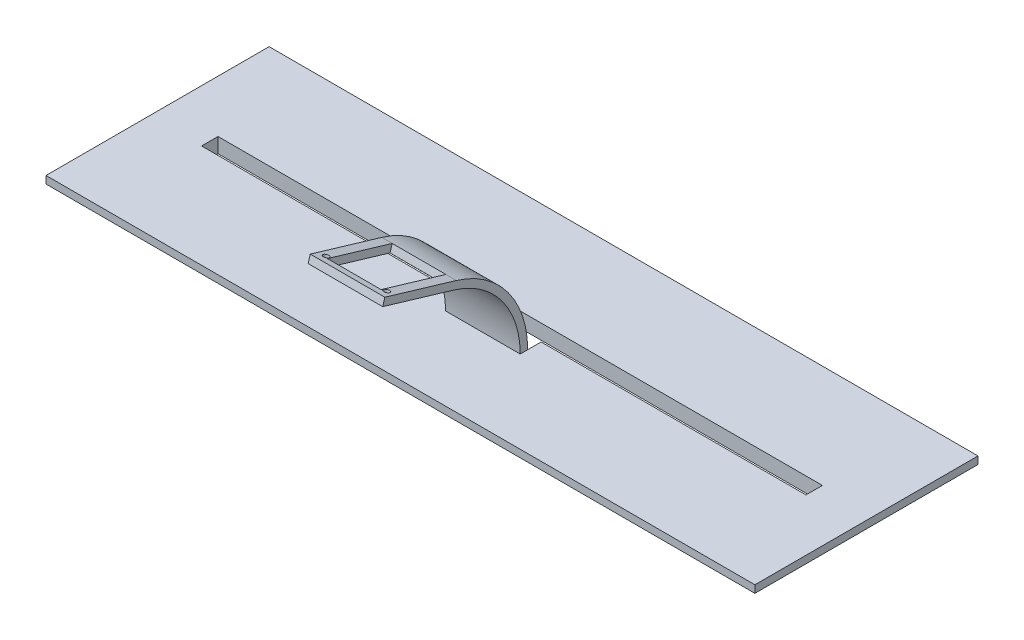
from build123d import *

# Parameters (mm, degrees)
SKETCH1_W                = 234.95
SKETCH1_H                = 69.596
BOSS_EXTRUDE1_DEPTH      = 2.54
SKETCH2_W                = 241.3
SKETCH2_H                = 75.946
BOSS_EXTRUDE2_DEPTH      = 2.54
CUT_EXTRUDE2_DEPTH       = 127.5866408
BOSS_EXTRUDE7_DEPTH      = 12.7
BOSS_EXTRUDE7_DEPTH_BACK = 12.7
SKETCH5_W                = 25.4
SKETCH5_H                = 2.54
BOSS_EXTRUDE8_DEPTH      = 25.4
CUT_EXTRUDE3_REACH       = 141.202
SKETCH6_W                = 18.288
SKETCH6_H                = 23.01875
CUT_EXTRUDE4_REACH       = 141.202
SKETCH9_R                = 1


with BuildPart() as part:
    # Sketch1 → Boss-Extrude1 (new body)
    with BuildSketch(Plane(origin=(0, 0, 0), x_dir=(1, 0, 0), z_dir=(0, 1, 0))):
        Rectangle(SKETCH1_W, SKETCH1_H)
    extrude(amount=BOSS_EXTRUDE1_DEPTH)

    # Sketch2 → Boss-Extrude2 (add)
    with BuildSketch(Plane(origin=(0, 2.54, 0), x_dir=(1, 0, 0), z_dir=(0, 1, 0))):
        Rectangle(SKETCH2_W, SKETCH2_H)
    extrude(amount=BOSS_EXTRUDE2_DEPTH)

    # Sketch3 → Cut-Extrude2 (cut, through all)
    with BuildSketch(Plane(origin=(0, 5.08, 0), x_dir=(1, 0, 0), z_dir=(0, 1, 0))):
        Polygon((102.87, 2.794), (-102.87, 2.794), (-102.87, -2.794), (-12.7, -2.794), (-12.7, -7.366), (12.7, -7.366), (12.7, -2.794), (102.87, -2.794), align=None)
    extrude(amount=-CUT_EXTRUDE2_DEPTH, mode=Mode.SUBTRACT)

    # Sketch4 → Boss-Extrude7 (add, two sides: drawn at the far end of the back side and taken through both)
    with BuildSketch(Plane(origin=(0, 0, 0), x_dir=(0, 0, -1), z_dir=(1, 0, 0)).offset(-BOSS_EXTRUDE7_DEPTH_BACK)):
        with BuildLine():
            Line((-9.906, 5.08), (-7.366, 5.08))
            ThreePointArc((-7.366, 5.08), (-14.100516916, 25.378557843), (-31.632923931, 37.626001367))
            Line((-31.632923931, 37.626001367), (-32.357814508, 35.191636223))
            ThreePointArc((-32.357814508, 35.191636223), (-16.136790727, 23.860272966), (-9.906, 5.08))
        make_face()
    extrude(amount=BOSS_EXTRUDE7_DEPTH + BOSS_EXTRUDE7_DEPTH_BACK)

    # Sketch5 → Boss-Extrude8 (add)
    with BuildSketch(Plane(origin=(0, 11.716812065, 39.348006133), x_dir=(1, 0, 0), z_dir=(0, 0.28538999106052765, 0.9584114737431267))):
        with Locations((0, 25.763471543)):
            Rectangle(SKETCH5_W, SKETCH5_H)
    extrude(amount=BOSS_EXTRUDE8_DEPTH)

    # Sketch6 → Cut-Extrude3 (cut, up to next)
    with BuildSketch(Plane(origin=(0, 25.909189302, -7.715082202), x_dir=(1, 0, 0), z_dir=(0, 0.9584114737431267, -0.28538999106052765)), mode=Mode.PRIVATE) as cut_extrude3_sk1:
        with Locations((0, -52.564816437)):
            Rectangle(SKETCH6_W, SKETCH6_H)
    cut_extrude3_tool1 = extrude(cut_extrude3_sk1.sketch, amount=-CUT_EXTRUDE3_REACH, mode=Mode.PRIVATE) & part.part
    add(cut_extrude3_tool1.solids().sort_by_distance((0, 40.910662, 42.663641))[0], mode=Mode.SUBTRACT)

    # Sketch9 → Cut-Extrude4 (cut, up to next)
    with BuildSketch(Plane(origin=(0, 25.909189302, -7.715082202), x_dir=(1, 0, 0), z_dir=(0, 0.9584114737431267, -0.28538999106052776)), mode=Mode.PRIVATE) as cut_extrude4_sk1:
        with Locations((-10.31875, -63.280441437)):
            Circle(SKETCH9_R)
    cut_extrude4_tool1 = extrude(cut_extrude4_sk1.sketch, amount=-CUT_EXTRUDE4_REACH, mode=Mode.PRIVATE) & part.part
    # Sketch9 → Cut-Extrude4 (cut, up to next)
    with BuildSketch(Plane(origin=(0, 25.909189302, -7.715082202), x_dir=(1, 0, 0), z_dir=(0, 0.9584114737431267, -0.28538999106052776)), mode=Mode.PRIVATE) as cut_extrude4_sk2:
        with Locations((10.31875, -63.280441437)):
            Circle(SKETCH9_R)
    cut_extrude4_tool2 = extrude(cut_extrude4_sk2.sketch, amount=-CUT_EXTRUDE4_REACH, mode=Mode.PRIVATE) & part.part
    add(cut_extrude4_tool1.solids().sort_by_distance((-10.31875, 43.968794, 52.933619))[0], mode=Mode.SUBTRACT)
    add(cut_extrude4_tool2.solids().sort_by_distance((10.31875, 43.968794, 52.933619))[0], mode=Mode.SUBTRACT)


solid = part.part
